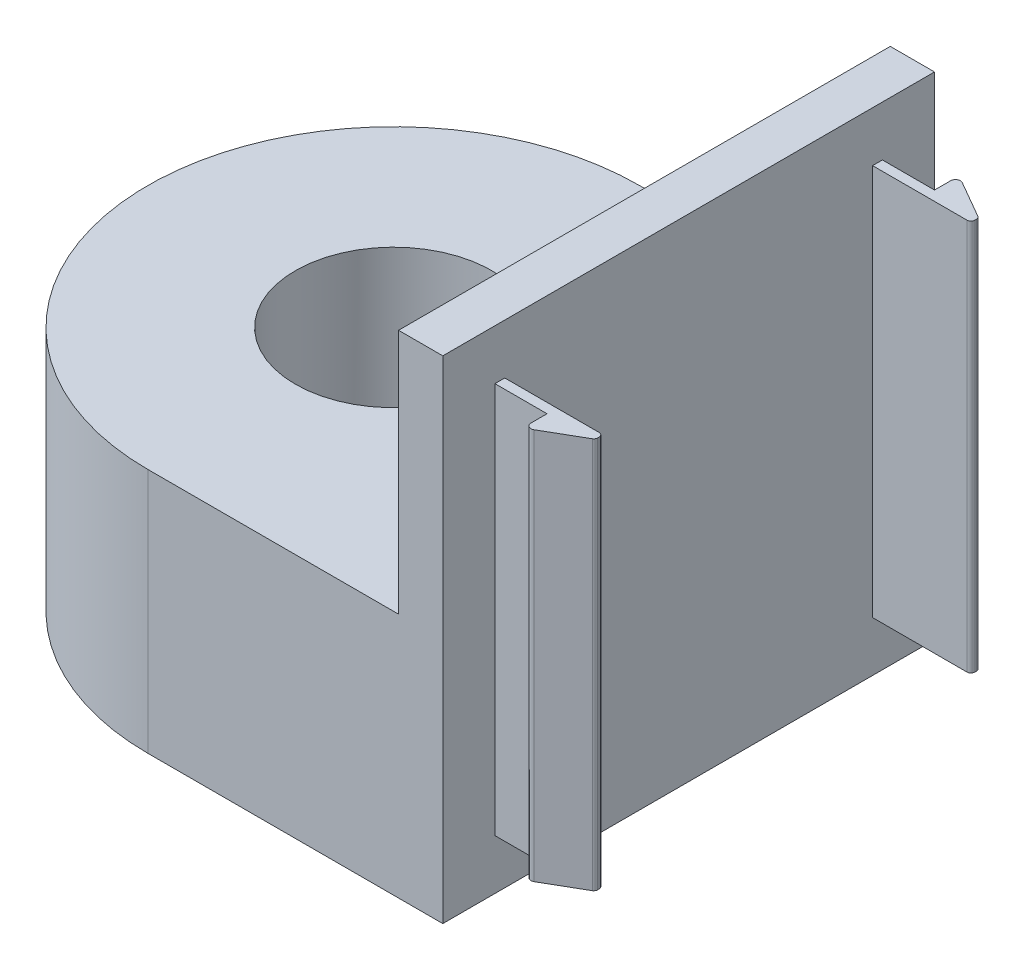
from build123d import *

# Parameters (mm, degrees)
BOSS_EXTRUDE2_DEPTH = 50
CUT_EXTRUDE1_START  = -25
CUT_EXTRUDE1_DEPTH  = 25
SKETCH5_R           = 10
CUT_EXTRUDE3_DEPTH  = 76
SKETCH10_R          = 15
CUT_EXTRUDE4_DEPTH  = 5
SKETCH17_W          = 50
SKETCH17_H          = 5.1
CUT_EXTRUDE5_DEPTH  = 90.582364336
FILLET1_R           = 0.4
FILLET2_R           = 0.5


with BuildPart() as part:
    # Sketch3 → Boss-Extrude2 (new body)
    with BuildSketch(Plane(origin=(0, 0, 0), x_dir=(1, 0, 0), z_dir=(0, 1, 0))):
        with BuildLine():
            Line((5, 44.7), (10.3, 44.7))
            Line((10.3, 44.7), (10.3, 47.2))
            Line((10.3, 47.2), (15, 44.486453735))
            Line((15, 44.486453735), (15, 43.7))
            Line((15, 43.7), (5, 43.7))
            Line((5, 43.7), (5, 6.3))
            Line((5, 6.3), (15, 6.3))
            Line((15, 6.3), (15, 5.513546265))
            Line((15, 5.513546265), (10.3, 2.8))
            Line((10.3, 2.8), (10.3, 5.3))
            Line((10.3, 5.3), (5, 5.3))
            Line((5, 5.3), (5, 0))
            Line((5, 0), (0, 0))
            Line((0, 0), (-25, 0))
            ThreePointArc((-25, 0), (-50, 25), (-25, 50))
            Line((-25, 50), (0, 50))
            Line((0, 50), (5, 50))
            Line((5, 50), (5, 44.7))
        make_face()
    extrude(amount=BOSS_EXTRUDE2_DEPTH)

    # Sketch4 → Cut-Extrude1 (cut)
    with BuildSketch(Plane(origin=(0, 50, 0), x_dir=(1, 0, 0), z_dir=(0, 1, 0)).offset(CUT_EXTRUDE1_START)):
        with BuildLine():
            Line((-25, 0), (0, 0))
            Line((0, 0), (0.5, 0))
            Line((0.5, 0), (0.5, 50))
            Line((0.5, 50), (0, 50))
            Line((0, 50), (-25, 50))
            ThreePointArc((-25, 50), (-42.67766953, 42.67766953), (-50, 25))
            ThreePointArc((-50, 25), (-42.67766953, 7.32233047), (-25, 0))
        make_face()
    extrude(amount=CUT_EXTRUDE1_DEPTH, mode=Mode.SUBTRACT)

    # Sketch5 → Cut-Extrude3 (cut, through all)
    with BuildSketch(Plane(origin=(0, 25, 0), x_dir=(1, 0, 0), z_dir=(0, 1, 0))):
        with Locations((-25, 25)):
            Circle(SKETCH5_R)
    extrude(amount=-CUT_EXTRUDE3_DEPTH, mode=Mode.SUBTRACT)

    # Sketch10 → Cut-Extrude4 (cut)
    with BuildSketch(Plane.XZ):
        with Locations((-25, -25)):
            Circle(SKETCH10_R)
    extrude(amount=-CUT_EXTRUDE4_DEPTH, mode=Mode.SUBTRACT)

    # Sketch17 → Cut-Extrude5 (cut, through all)
    with BuildSketch(Plane(origin=(5, 0, 0), x_dir=(0, 0, -1), z_dir=(1, 0, 0))):
        with Locations((25, 2.55)):
            Rectangle(SKETCH17_W, SKETCH17_H)
        with Locations((25, 47.45)):
            Rectangle(SKETCH17_W, SKETCH17_H)
    extrude(amount=CUT_EXTRUDE5_DEPTH, mode=Mode.SUBTRACT)

    # Fillet1
    fillet1_edges = [part.edges().sort_by_distance(p)[0] for p in [
        (15, 25, -43.7),
        (15, 25, -44.486453735),
        (15, 25, -6.3),
        (15, 25, -5.513546265),
    ]]
    fillet(fillet1_edges, radius=FILLET1_R)

    # Fillet2
    fillet2_edges = [part.edges().sort_by_distance(p)[0] for p in [
        (10.3, 25, -47.2),
        (10.3, 25, -2.8),
    ]]
    fillet(fillet2_edges, radius=FILLET2_R)


solid = part.part
